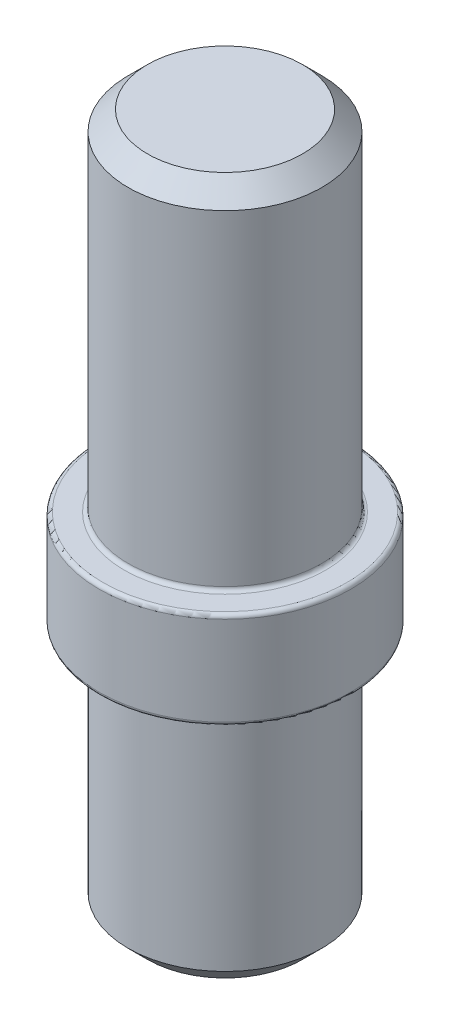
from build123d import *

# Parameters (mm, degrees)
CHAMFER_1_SIZE = 1
FILLET_1_R     = 0.2


with BuildPart() as part:
    # 草图1 → 旋转1 (revolve)
    with BuildSketch(Plane.XY):
        Polygon((0, 23), (5, 23), (5, 5), (6.5, 5), (6.5, 0), (5, 0), (5, -13), (0, -13), align=None)
    revolve(axis=Axis((0, 23.073688006, 0), (0, -1, 0)))

    # 倒角1
    chamfer_1_edges = [part.edges().sort_by_distance(p)[0] for p in [
        (-5, -13, 0),
        (-5, 23, 0),
    ]]
    chamfer(chamfer_1_edges, length=CHAMFER_1_SIZE)

    # 圆角1
    fillet_1_edges = [part.edges().sort_by_distance(p)[0] for p in [
        (-5, 0, 0),
        (-6.5, 0, 0),
        (-6.5, 5, 0),
        (-5, 5, 0),
    ]]
    fillet(fillet_1_edges, radius=FILLET_1_R)


solid = part.part
